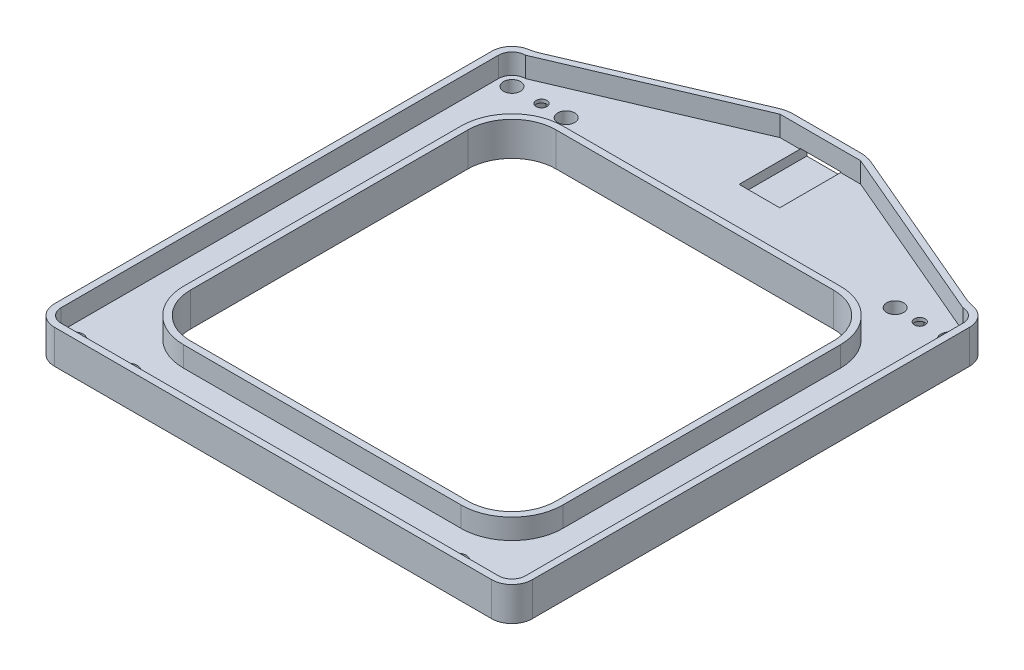
from build123d import *

# Parameters (mm, degrees)
BOSS_EXTRUDE1_DEPTH = 10
CUT_EXTRUDE1_DEPTH  = 6
SKETCH3_R           = 2.5
SKETCH3_R_2         = 1.6
CUT_EXTRUDE5_DEPTH  = 118.268793803
CUT_EXTRUDE6_DEPTH  = 3
FILLET1_R           = 10
SKETCH7_W           = 12
SKETCH7_H           = 3
CUT_EXTRUDE7_DEPTH  = 20


with BuildPart() as part:
    # Sketch1 → Boss-Extrude1 (new body)
    with BuildSketch(Plane(origin=(0, 0, 0), x_dir=(1, 0, 0), z_dir=(0, 1, 0))):
        with BuildLine():
            Line((-64.6, 70.6), (-13.781138102, 92.296857547))
            ThreePointArc((-13.781138102, 92.296857547), (-11.858510235, 92.897157125), (-9.854586018, 93.1))
            Line((-9.854586018, 93.1), (9.854586018, 93.1))
            ThreePointArc((9.854586018, 93.1), (11.858510235, 92.897157125), (13.781138102, 92.296857547))
            Line((13.781138102, 92.296857547), (64.6, 70.6))
            ThreePointArc((64.6, 70.6), (68.842640687, 68.842640687), (70.6, 64.6))
            Line((70.6, 64.6), (70.6, -64.6))
            ThreePointArc((70.6, -64.6), (68.842640687, -68.842640687), (64.6, -70.6))
            Line((64.6, -70.6), (-64.6, -70.6))
            ThreePointArc((-64.6, -70.6), (-68.842640687, -68.842640687), (-70.6, -64.6))
            Line((-70.6, -64.6), (-70.6, 64.6))
            ThreePointArc((-70.6, 64.6), (-68.842640687, 68.842640687), (-64.6, 70.6))
        make_face()
        with BuildLine():
            Line((-41, -54), (41, -54))
            ThreePointArc((41, -54), (50.192388155, -50.192388155), (54, -41))
            Line((54, -41), (54, 41))
            ThreePointArc((54, 41), (50.192388155, 50.192388155), (41, 54))
            Line((41, 54), (-41, 54))
            ThreePointArc((-41, 54), (-50.192388155, 50.192388155), (-54, 41))
            Line((-54, 41), (-54, -41))
            ThreePointArc((-54, -41), (-50.192388155, -50.192388155), (-41, -54))
        make_face(mode=Mode.SUBTRACT)
    extrude(amount=BOSS_EXTRUDE1_DEPTH)

    # Sketch2 → Cut-Extrude1 (cut)
    with BuildSketch(Plane(origin=(0, 10, 0), x_dir=(1, 0, 0), z_dir=(0, 1, 0))):
        with BuildLine():
            Line((-64.6, 68.6), (-11.9, 91.1))
            Line((-11.9, 91.1), (11.9, 91.1))
            Line((11.9, 91.1), (64.6, 68.6))
            ThreePointArc((64.6, 68.6), (67.428427125, 67.428427125), (68.6, 64.6))
            Line((68.6, 64.6), (68.6, -64.6))
            ThreePointArc((68.6, -64.6), (67.428427125, -67.428427125), (64.6, -68.6))
            Line((64.6, -68.6), (-64.6, -68.6))
            ThreePointArc((-64.6, -68.6), (-67.428427125, -67.428427125), (-68.6, -64.6))
            Line((-68.6, -64.6), (-68.6, 64.6))
            ThreePointArc((-68.6, 64.6), (-67.428427125, 67.428427125), (-64.6, 68.6))
        make_face()
        with BuildLine():
            Line((-41, -56), (41, -56))
            ThreePointArc((41, -56), (51.606601718, -51.606601718), (56, -41))
            Line((56, -41), (56, 41))
            ThreePointArc((56, 41), (51.606601718, 51.606601718), (41, 56))
            Line((41, 56), (-41, 56))
            ThreePointArc((-41, 56), (-51.606601718, 51.606601718), (-56, 41))
            Line((-56, 41), (-56, -41))
            ThreePointArc((-56, -41), (-51.606601718, -51.606601718), (-41, -56))
        make_face(mode=Mode.SUBTRACT)
    extrude(amount=-CUT_EXTRUDE1_DEPTH, mode=Mode.SUBTRACT)

    # Sketch3 → Cut-Extrude5 (cut, through all)
    with BuildSketch(Plane(origin=(0, 0, 0), x_dir=(1, 0, 0), z_dir=(0, 1, 0))):
        with Locations((-64.6, 64.6)):
            Circle(SKETCH3_R)
        with Locations((-48.6, 64.6)):
            Circle(SKETCH3_R)
        with Locations((-55.87, 64.6)):
            Circle(SKETCH3_R_2)
        with Locations((55.87, 64.6)):
            Circle(SKETCH3_R_2)
        with Locations((48.6, 64.6)):
            Circle(SKETCH3_R)
        with Locations((64.6, 64.6)):
            Circle(SKETCH3_R)
        with Locations((64.6, -64.6)):
            Circle(SKETCH3_R)
        with Locations((48.6, -64.6)):
            Circle(SKETCH3_R)
        with Locations((55.87, -64.6)):
            Circle(SKETCH3_R_2)
        with Locations((-55.87, -64.6)):
            Circle(SKETCH3_R_2)
        with Locations((-48.6, -64.6)):
            Circle(SKETCH3_R)
        with Locations((-64.6, -64.6)):
            Circle(SKETCH3_R)
    extrude(amount=CUT_EXTRUDE5_DEPTH, mode=Mode.SUBTRACT)

    # Sketch6 → Cut-Extrude6 (cut)
    with BuildSketch(Plane.XZ):
        Polygon((-52.405898385, 64.6), (-54.137949192, 67.6), (-57.602050808, 67.6), (-59.334101615, 64.6), (-57.602050808, 61.6), (-54.137949192, 61.6), align=None)
        Polygon((-54.137949192, -61.6), (-52.405898385, -64.6), (-54.137949192, -67.6), (-57.602050808, -67.6), (-59.334101615, -64.6), (-57.602050808, -61.6), align=None)
        Polygon((52.405898385, -64.6), (54.137949192, -67.6), (57.602050808, -67.6), (59.334101615, -64.6), (57.602050808, -61.6), (54.137949192, -61.6), align=None)
        Polygon((54.137949192, 61.6), (52.405898385, 64.6), (54.137949192, 67.6), (57.602050808, 67.6), (59.334101615, 64.6), (57.602050808, 61.6), align=None)
    extrude(amount=-CUT_EXTRUDE6_DEPTH, mode=Mode.SUBTRACT)

    # Fillet1
    fillet1_edges = [part.edges().sort_by_distance(p)[0] for p in [
        (64.6, 5, -70.6),
        (-64.6, 5, -70.6),
    ]]
    fillet(fillet1_edges, radius=FILLET1_R)

    # Sketch7 → Cut-Extrude7 (cut)
    with BuildSketch(Plane(origin=(0, 0, -93.1), x_dir=(-1, 0, 0), z_dir=(0, 0, -1))):
        with Locations((0, 2.73)):
            Rectangle(SKETCH7_W, SKETCH7_H)
    extrude(amount=-CUT_EXTRUDE7_DEPTH, mode=Mode.SUBTRACT)


solid = part.part
